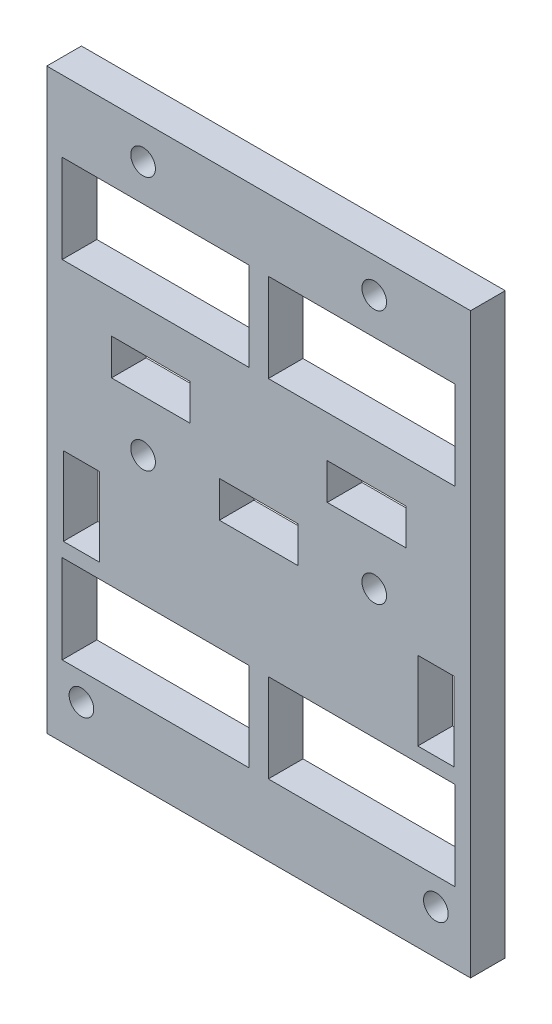
from build123d import *

# Parameters (mm, degrees)
SKETCH1_W           = 55
SKETCH1_H           = 75
SKETCH1_W_2         = 24.25
SKETCH1_H_2         = 11.5
BOSS_EXTRUDE1_DEPTH = 4.5
SKETCH2_R           = 1.6
SCREWHOLES_DEPTH    = 47.719910103
SKETCH3_W           = 10.2
SKETCH3_H           = 4.7
BELTCLAMP_DEPTH     = 47.719910103
SKETCH4_W           = 10.2
SKETCH4_H           = 4.7
CUT_EXTRUDE3_DEPTH  = 47.719910103
SKETCH5_R           = 1.6
SKETCH5_W           = 4.7
SKETCH5_H           = 10.2
CUT_EXTRUDE4_DEPTH  = 47.719910103


with BuildPart() as part:
    # Sketch1 → Boss-Extrude1 (new body)
    with BuildSketch(Plane.XY):
        Rectangle(SKETCH1_W, SKETCH1_H)
        with Locations((-13.375, 22.5)):
            Rectangle(SKETCH1_W_2, SKETCH1_H_2, mode=Mode.SUBTRACT)
        with Locations((13.375, 22.5)):
            Rectangle(SKETCH1_W_2, SKETCH1_H_2, mode=Mode.SUBTRACT)
        with Locations((13.375, -22.5)):
            Rectangle(SKETCH1_W_2, SKETCH1_H_2, mode=Mode.SUBTRACT)
        with Locations((-13.375, -22.5)):
            Rectangle(SKETCH1_W_2, SKETCH1_H_2, mode=Mode.SUBTRACT)
    extrude(amount=BOSS_EXTRUDE1_DEPTH)

    # Sketch2 → screwHoles (cut, through all)
    with BuildSketch(Plane.XY.offset(4.5)):
        with Locations((-15, 33)):
            Circle(SKETCH2_R)
        with Locations((15, 33)):
            Circle(SKETCH2_R)
        with Locations((15, 0)):
            Circle(SKETCH2_R)
        with Locations((-15, 0)):
            Circle(SKETCH2_R)
    extrude(amount=-SCREWHOLES_DEPTH, mode=Mode.SUBTRACT)

    # Sketch3 → BeltClamp (cut, through all)
    with BuildSketch(Plane.XY.offset(4.5)):
        with Locations((-14, 9)):
            Rectangle(SKETCH3_W, SKETCH3_H)
        with Locations((14, 9)):
            Rectangle(SKETCH3_W, SKETCH3_H)
    extrude(amount=-BELTCLAMP_DEPTH, mode=Mode.SUBTRACT)

    # Sketch4 → Cut-Extrude3 (cut, through all)
    with BuildSketch(Plane.XY.offset(4.5)):
        Rectangle(SKETCH4_W, SKETCH4_H)
    extrude(amount=-CUT_EXTRUDE3_DEPTH, mode=Mode.SUBTRACT)

    # Sketch5 → Cut-Extrude4 (cut, through all)
    with BuildSketch(Plane.XY.offset(4.5)):
        with Locations((23, -31.75)):
            Circle(SKETCH5_R)
        with Locations((-23, -31.75)):
            Circle(SKETCH5_R)
        with Locations((23, -9.75)):
            Rectangle(SKETCH5_W, SKETCH5_H)
        with Locations((-23, -9.75)):
            Rectangle(SKETCH5_W, SKETCH5_H)
    extrude(amount=-CUT_EXTRUDE4_DEPTH, mode=Mode.SUBTRACT)


solid = part.part
